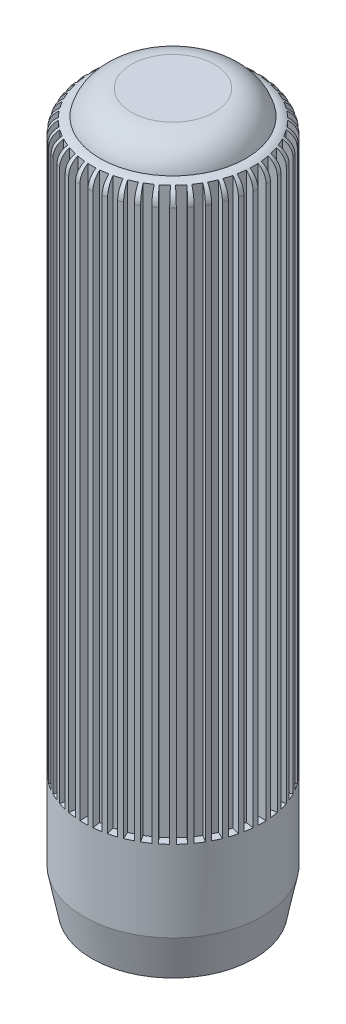
from build123d import *

# Parameters (mm, degrees)
SKETCH1_R           = 11
BOSS_EXTRUDE1_DEPTH = 85
SKETCH2_R           = 9
BOSS_EXTRUDE2_DEPTH = 3
FILLET1_R           = 4
SKETCH3_W           = 1
SKETCH3_H           = 1
CUT_EXTRUDE1_DEPTH  = 70
CIRPATTERN1_COUNT   = 44
CHAMFER1_SIZE       = 1
CHAMFER1_SIZE2      = 5


with BuildPart() as part:
    # Sketch1 → Boss-Extrude1 (new body)
    with BuildSketch(Plane(origin=(0, 0, 0), x_dir=(1, 0, 0), z_dir=(0, 1, 0))):
        with Locations(Location((0, 0, 0), (0, 0, 270))):
            Circle(SKETCH1_R)
    extrude(amount=BOSS_EXTRUDE1_DEPTH)

    # Sketch2 → Boss-Extrude2 (add)
    with BuildSketch(Plane(origin=(0, 85, 0), x_dir=(1, 0, 0), z_dir=(0, 1, 0))):
        with Locations(Location((0, 0, 0), (0, 0, 270))):
            Circle(SKETCH2_R)
    extrude(amount=BOSS_EXTRUDE2_DEPTH)

    # Fillet1
    # the kernel refuses this fillet: 4 mm, written as the material it takes off along each edge
    with BuildSketch(Plane(origin=(0, 88, 0), x_dir=(0, 0, 1), z_dir=(-1, 0, 0))) as fillet1_piece_1:
        with BuildLine():
            CenterArc((5.127016654, -4), FILLET1_R, 14.477512186, 75.522487814)
            Line((5.127016654, 0), (5.127016654, 0.08))
            Line((5.127016654, 0.08), (9, 0.08))
            Line((9, 0.08), (9.08, 0))
            ThreePointArc((9.08, 0), (9.08, -1.5), (9.077459667, -2.98))
            Line((9.077459667, -2.98), (9, -3))
        make_face()
    revolve(axis=Axis((0, 88, 0), (0, 1, 0)), mode=Mode.SUBTRACT)

    # Shell1: read off the stored shape, not the designer's step
    # Shell1 outline → Shell1 (revolve, cut)
    with BuildSketch(Plane.XY):
        with BuildLine():
            Line((9, 0), (9, 83))
            Line((9, 83), (6.859067461, 83))
            ThreePointArc((6.859067461, 83), (6.859067461, 85), (5.127016654, 86))
            Line((5.127016654, 86), (0, 86))
            Line((0, 86), (0, 0))
            Line((0, 0), (9, 0))
        make_face()
    revolve(axis=Axis((0, 0, 0), (0, 1, 0)), mode=Mode.SUBTRACT)

    # Sketch3 → Cut-Extrude1 (cut)
    with BuildSketch(Plane(origin=(0, 85, 0), x_dir=(1, 0, 0), z_dir=(0, 1, 0))):
        with Locations((0, 10.5)):
            Rectangle(SKETCH3_W, SKETCH3_H)
    cut_extrude1 = extrude(amount=-CUT_EXTRUDE1_DEPTH, mode=Mode.SUBTRACT)

    # CirPattern1: Cut-Extrude1 ×44 about axis
    cirpattern1_axis = Axis((0, 0, 0), (0, 1, 0))
    for i in range(1, CIRPATTERN1_COUNT):
        add(cut_extrude1.rotate(cirpattern1_axis, i * 360 / CIRPATTERN1_COUNT), mode=Mode.SUBTRACT)

    # Fillet2: read off the stored shape, not the designer's step
    # Fillet2 outline → Fillet2 (revolve, cut)
    with BuildSketch(Plane.XY):
        with BuildLine():
            ThreePointArc((9, 85), (10.414213562, 84.414213562), (11, 83))
            Line((11, 83), (11, 85))
            Line((11, 85), (9, 85))
        make_face()
    revolve(axis=Axis((0, 0, 0), (0, 1, 0)), mode=Mode.SUBTRACT)

    # Chamfer1
    chamfer1_edges = [part.edges().sort_by_distance(p)[0] for p in [
        (0, 0, -11),
    ]]
    chamfer1_side = [part.faces().sort_by_distance(p)[0] for p in [
        (0, 0, -10.688873016),
    ]]
    chamfer(chamfer1_edges, length=CHAMFER1_SIZE, length2=CHAMFER1_SIZE2, reference=chamfer1_side[0])


solid = part.part
